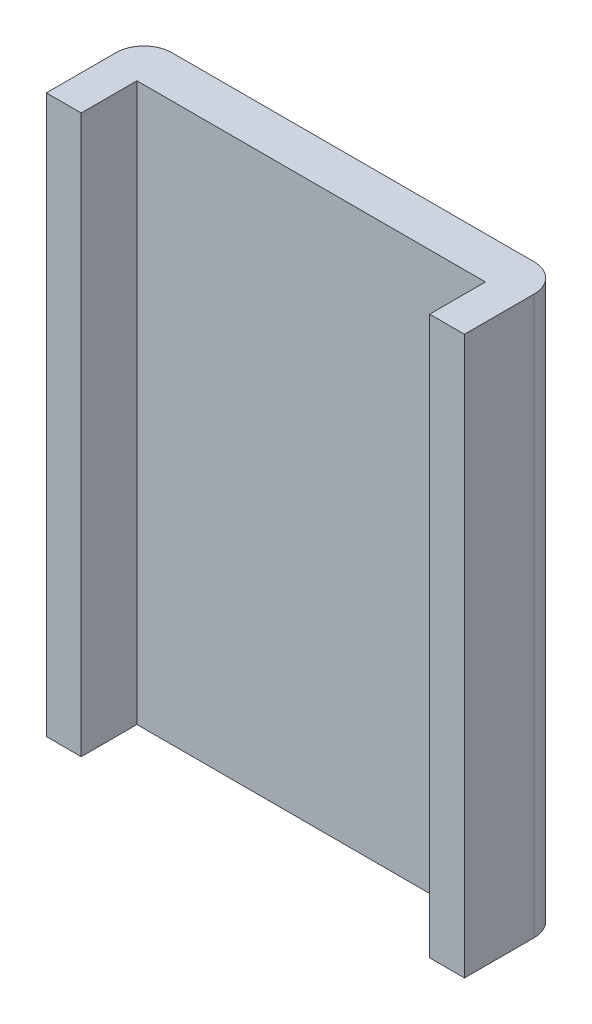
from build123d import *

# Parameters (mm, degrees)
SKETCH1_W           = 6.25
SKETCH1_H           = 10
BOSS_EXTRUDE1_DEPTH = 0.75
SKETCH1_3_W         = 0.625
SKETCH1_3_H         = 10
BOSS_EXTRUDE2_DEPTH = 1.75
FILLET1_R           = 0.5


with BuildPart() as part:
    # Sketch1 → Boss-Extrude1 (new body)
    with BuildSketch(Plane.XY):
        Rectangle(SKETCH1_W, SKETCH1_H)
    extrude(amount=BOSS_EXTRUDE1_DEPTH)

    # Sketch1<3> → Boss-Extrude2 (add)
    with BuildSketch(Plane.XY):
        with Locations((-3.4375, 0)):
            Rectangle(SKETCH1_3_W, SKETCH1_3_H)
        with Locations((3.4375, 0)):
            Rectangle(SKETCH1_3_W, SKETCH1_3_H)
    extrude(amount=BOSS_EXTRUDE2_DEPTH)

    # Fillet1
    fillet1_edges = [part.edges().sort_by_distance(p)[0] for p in [
        (-3.75, 0, 0),
        (3.75, 0, 0),
    ]]
    fillet(fillet1_edges, radius=FILLET1_R)


solid = part.part
